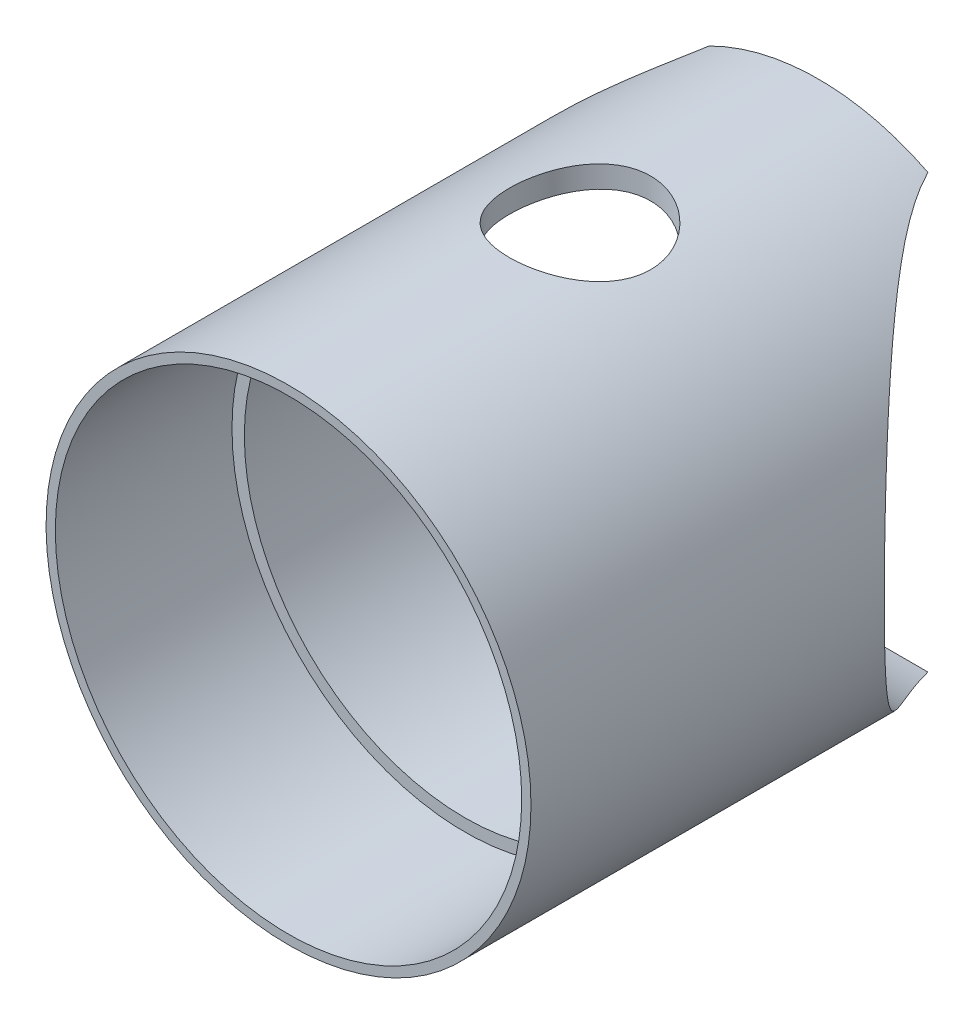
from build123d import *

# Parameters (mm, degrees)
SKETCH2_R           = 34.8615
SKETCH2_R_2         = 33.528
BOSS_EXTRUDE1_DEPTH = 25.4
BOSS_EXTRUDE2_START = 50.8
SKETCH3_R           = 34.8615
BOSS_EXTRUDE2_DEPTH = 50.8
SKETCH4_R           = 31.75
CUT_EXTRUDE2_DEPTH  = 94.044402901
SKETCH6_R           = 31.75
CUT_EXTRUDE4_DEPTH  = 50.8
CUT_EXTRUDE5_REACH  = 95.044
SKETCH7_R           = 10.16


with BuildPart() as part:
    # Sketch2 → Boss-Extrude1 (new body)
    with BuildSketch(Plane.XY):
        Circle(SKETCH2_R)
        Circle(SKETCH2_R_2, mode=Mode.SUBTRACT)
    extrude(amount=BOSS_EXTRUDE1_DEPTH)

    # Sketch3 → Boss-Extrude2 (add)
    with BuildSketch(Plane(origin=(0, 0, 0), x_dir=(-1, 0, 0), z_dir=(0, 0, -1)).offset(BOSS_EXTRUDE2_START)):
        Circle(SKETCH3_R)
    extrude(amount=-BOSS_EXTRUDE2_DEPTH)

    # Sketch4 → Cut-Extrude2 (cut, through all)
    with BuildSketch(Plane(origin=(34.8615, 0, 0), x_dir=(0, 0, -1), z_dir=(1, 0, 0))):
        with Locations((57.15, 0)):
            Circle(SKETCH4_R)
    extrude(amount=-CUT_EXTRUDE2_DEPTH, mode=Mode.SUBTRACT)

    # Sketch6 → Cut-Extrude4 (cut)
    with BuildSketch(Plane.XY):
        Circle(SKETCH6_R)
    extrude(amount=-CUT_EXTRUDE4_DEPTH, mode=Mode.SUBTRACT)

    # Sketch7 → Cut-Extrude5 (cut, up to next)
    with BuildSketch(Plane(origin=(0, 34.8615, 0), x_dir=(-1, 0, 0), z_dir=(0, 1, 0)), mode=Mode.PRIVATE) as cut_extrude5_sk1:
        with Locations((0, -16.51)):
            Circle(SKETCH7_R)
    cut_extrude5_tool1 = extrude(cut_extrude5_sk1.sketch, amount=-CUT_EXTRUDE5_REACH, mode=Mode.PRIVATE) & part.part
    add(cut_extrude5_tool1.solids().sort_by_distance((0, 34.8615, -16.51))[0], mode=Mode.SUBTRACT)


solid = part.part
